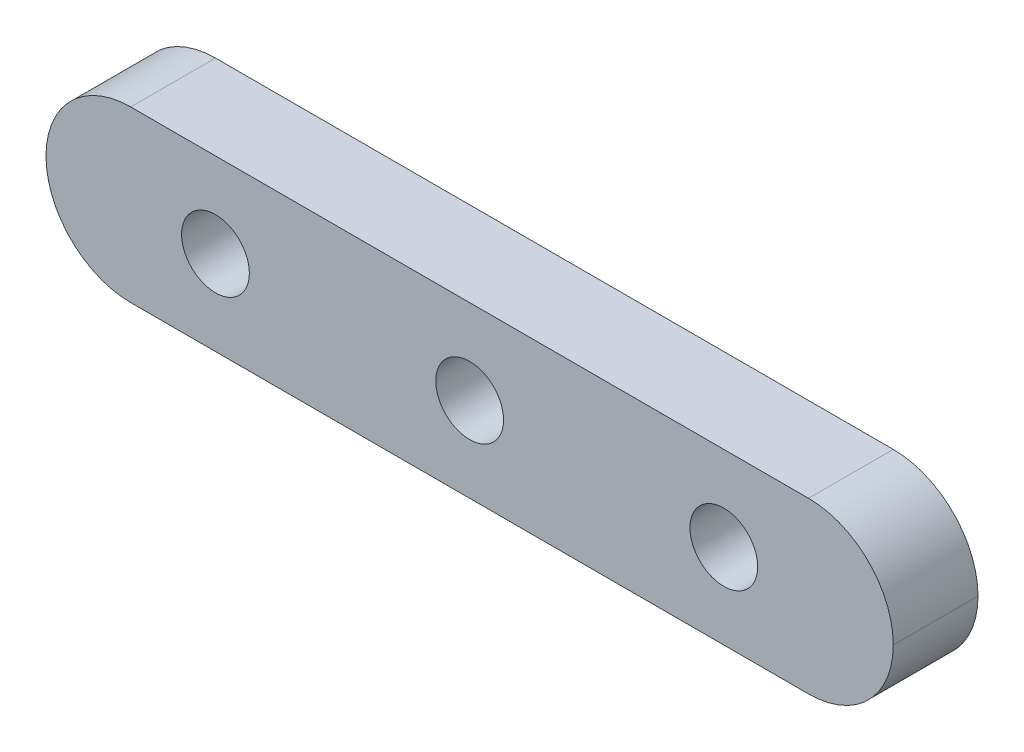
from build123d import *

# Parameters (mm, degrees)
SKETCH_1_W      = 50
SKETCH_1_H      = 10
SKETCH_1_R      = 2
EXTRUDE_1_DEPTH = 5
FILLET_1_R      = 5


with BuildPart() as part:
    # 草图1 → 凸台-拉伸1 (new body)
    with BuildSketch(Plane.XY):
        Rectangle(SKETCH_1_W, SKETCH_1_H)
        with Locations((-15, 0)):
            Circle(SKETCH_1_R, mode=Mode.SUBTRACT)
        with Locations(Location((15, 0, 0), (0, 0, 180))):
            Circle(SKETCH_1_R, mode=Mode.SUBTRACT)
        Circle(SKETCH_1_R, mode=Mode.SUBTRACT)
    extrude(amount=EXTRUDE_1_DEPTH)

    # 圆角1
    fillet_1_edges = [part.edges().sort_by_distance(p)[0] for p in [
        (25, -5, 2.5),
        (25, 5, 2.5),
        (-25, -5, 2.5),
        (-25, 5, 2.5),
    ]]
    fillet(fillet_1_edges, radius=FILLET_1_R - 0.0001)  # a hair under: the kernel refuses the full size


solid = part.part
